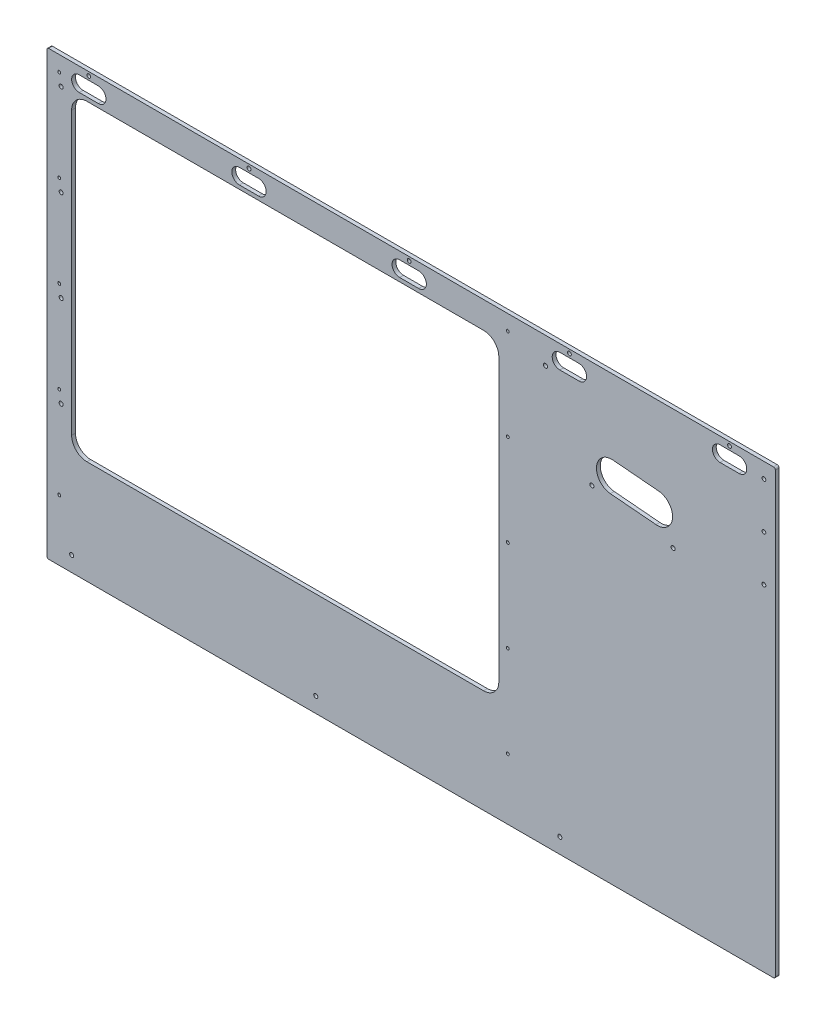
from build123d import *

# Parameters (mm, degrees)
SKETCH1_W                   = 1212.85
SKETCH1_H                   = 736.6
BOSS_EXTRUDE1_DEPTH         = 6.35
H_0_266_DIAMETER_HOLE1_D    = 6.7564
SKETCH2_R                   = 2.45745
SKETCH2_W                   = 711.2
SKETCH2_H                   = 519.684
CUT_EXTRUDE1_DEPTH          = 710.532587782
H_0_266_DIAMETER_HOLE2_D    = 6.7564
H_0_266_DIAMETER_HOLE3_D    = 6.7564
SKETCH12_R                  = 3.175
CUT_EXTRUDE4_DEPTH          = 710.532587782
LPATTERN1_COUNT             = 5
LPATTERN1_PITCH             = 266.7
FILLET1_R                   = 3.175
CUT_EXTRUDE5_DEPTH          = 710.532587782
F_1_4_0_25_DIAMETER_HOLE1_D = 6.35
FILLET2_R                   = 25.4


with BuildPart() as part:
    # Sketch1 → Boss-Extrude1 (new body)
    with BuildSketch(Plane.XY):
        Rectangle(SKETCH1_W, SKETCH1_H)
    extrude(amount=BOSS_EXTRUDE1_DEPTH)

    # H (0.266) Diameter Hole1 (through all)
    with Locations(Plane.XY.offset(6.35)):
        with Locations((-565.15, -342.9), (-158.75, -342.9), (247.65, -342.9)):
            Hole(H_0_266_DIAMETER_HOLE1_D / 2)

    # Sketch2 → Cut-Extrude1 (cut, through all)
    with BuildSketch(Plane.XY.offset(6.35)):
        with Locations((-585.7875, 342.9)):
            Circle(SKETCH2_R)
        with Locations((-585.7875, 190.5)):
            Circle(SKETCH2_R)
        with Locations((-585.7875, 38.1)):
            Circle(SKETCH2_R)
        with Locations((-585.7875, -114.3)):
            Circle(SKETCH2_R)
        with Locations((-585.7875, -266.7)):
            Circle(SKETCH2_R)
        with Locations((160.9725, -266.7)):
            Circle(SKETCH2_R)
        with Locations((160.9725, -114.3)):
            Circle(SKETCH2_R)
        with Locations((160.9725, 38.1)):
            Circle(SKETCH2_R)
        with Locations((160.9725, 190.5)):
            Circle(SKETCH2_R)
        with Locations((160.9725, 342.9)):
            Circle(SKETCH2_R)
        with Locations((-209.55, 64.008)):
            Rectangle(SKETCH2_W, SKETCH2_H)
    extrude(amount=-CUT_EXTRUDE1_DEPTH, mode=Mode.SUBTRACT)

    # H (0.266) Diameter Hole2 (through all)
    with Locations(Plane.XY.offset(6.35)):
        with Locations((-582.6125, 323.596), (-582.6125, 171.196), (-582.6125, 18.796), (-582.6125, -133.604)):
            Hole(H_0_266_DIAMETER_HOLE2_D / 2)

    # H (0.266) Diameter Hole3 (through all)
    with Locations(Plane.XY.offset(6.35)):
        with Locations((223.770763786, 324.305909426), (436.157707656, 167.711380391), (301.059784222, 190.437399182)):
            Hole(H_0_266_DIAMETER_HOLE3_D / 2)

    # Sketch12 → Cut-Extrude4 (cut, through all)
    with BuildSketch(Plane.XY.offset(6.35)):
        with Locations((-536.575, 361.95)):
            Circle(SKETCH12_R)
        with BuildLine():
            Line((-552.45, 355.6), (-520.7, 355.6))
            ThreePointArc((-520.7, 355.6), (-508, 342.9), (-520.7, 330.2))
            Line((-520.7, 330.2), (-552.45, 330.2))
            ThreePointArc((-552.45, 330.2), (-565.15, 342.9), (-552.45, 355.6))
        make_face()
    cut_extrude4 = extrude(amount=-CUT_EXTRUDE4_DEPTH, mode=Mode.SUBTRACT)

    # LPattern1: Cut-Extrude4 ×5
    with Locations(*[(i * LPATTERN1_PITCH, 0, 0) for i in range(1, LPATTERN1_COUNT)]):
        add(cut_extrude4, mode=Mode.SUBTRACT)

    # Fillet1
    fillet1_edges = [part.edges().sort_by_distance(p)[0] for p in [
        (606.425, -368.3, 3.175),
        (606.425, 368.3, 3.175),
        (-606.425, -368.3, 3.175),
        (-606.425, 368.3, 3.175),
    ]]
    fillet(fillet1_edges, radius=FILLET1_R)

    # Sketch14 → Cut-Extrude5 (cut, through all)
    with BuildSketch(Plane.XY.offset(6.35)):
        with BuildLine():
            Line((336.240912114, 244.52397913), (412.150948109, 237.882711533))
            ThreePointArc((412.150948109, 237.882711533), (435.240537575, 210.365610336), (407.723436378, 187.27602087))
            Line((407.723436378, 187.27602087), (331.813400383, 193.917288467))
            ThreePointArc((331.813400383, 193.917288467), (308.723810917, 221.434389664), (336.240912114, 244.52397913))
        make_face()
    extrude(amount=-CUT_EXTRUDE5_DEPTH, mode=Mode.SUBTRACT)

    # 1/4 (0.25) Diameter Hole1 (through all)
    with Locations(Plane.XY.offset(6.35)):
        with Locations((587.375, 342.9), (587.375, 266.7), (587.375, 190.5)):
            Hole(F_1_4_0_25_DIAMETER_HOLE1_D / 2)

    # Fillet2
    fillet2_edges = [part.edges().sort_by_distance(p)[0] for p in [
        (146.05, 323.85, 3.175),
        (146.05, -195.834, 3.175),
        (-565.15, -195.834, 3.175),
        (-565.15, 323.85, 3.175),
    ]]
    fillet(fillet2_edges, radius=FILLET2_R)


solid = part.part
